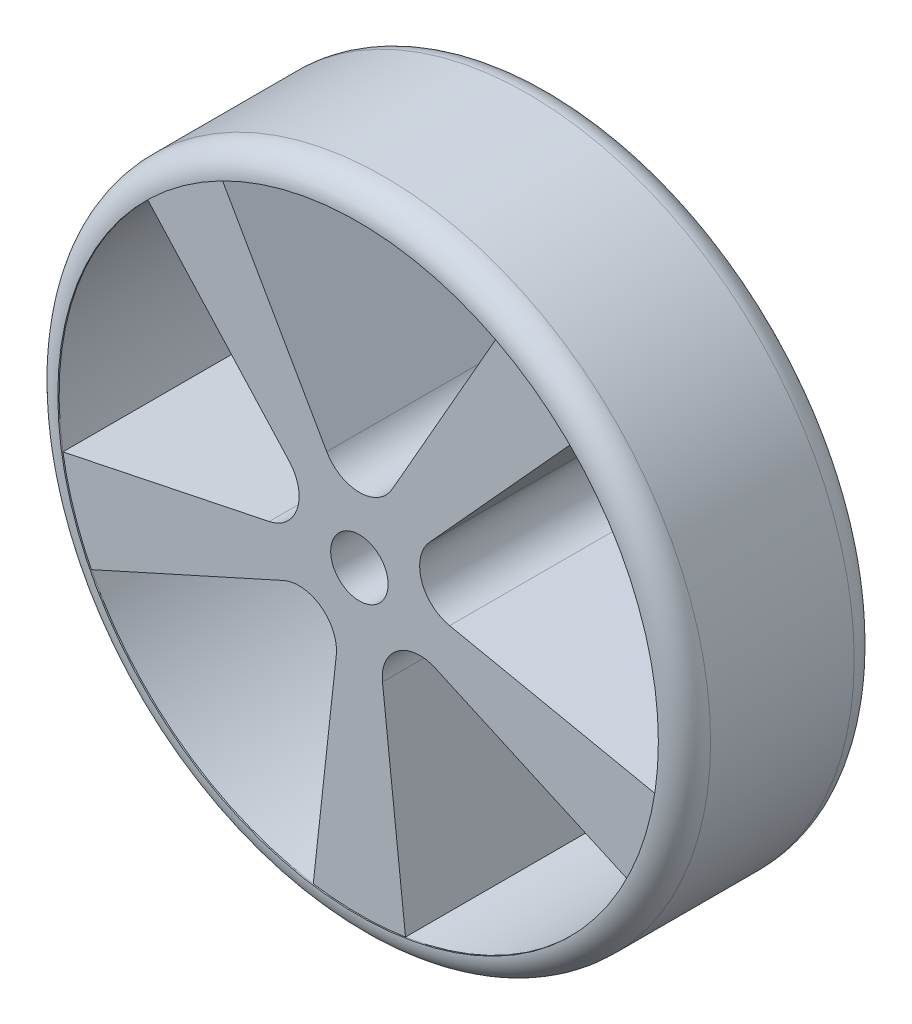
from build123d import *
from build123d.topology import SkipClean

# Parameters (mm, degrees)
SKETCH1_R               = 25
BOSS_EXTRUDE1_DEPTH     = 15
FILLET1_R               = 2
CUT_EXTRUDE2_DEPTH      = 39.405728804
CUT_EXTRUDE2_DEPTH_BACK = 39.405728804
SKETCH7_R               = 2.2
SKETCH8_R               = 23
CUT_EXTRUDE3_DEPTH      = 0.1
CUT_EXTRUDE4_START      = -0.1
SKETCH9_R               = 23
CUT_EXTRUDE4_DEPTH      = 0.1
BOSS_EXTRUDE3_START     = -0.1
SKETCH10_R              = 23
BOSS_EXTRUDE3_DEPTH     = 0.1
SKETCH11_R              = 2.2
CUT_EXTRUDE5_DEPTH      = 37.142080806
SKETCH12_R              = 23
BOSS_EXTRUDE4_DEPTH     = 0.1
SKETCH13_R              = 2.2
CUT_EXTRUDE6_DEPTH      = 39.366782573
CUT_EXTRUDE7_DEPTH      = 39.366782573
CIRPATTERN1_COUNT       = 5


with BuildPart() as part:
    # Sketch1 → Boss-Extrude1 (new body)
    with BuildSketch(Plane.XY):
        Circle(SKETCH1_R)
    extrude(amount=BOSS_EXTRUDE1_DEPTH)

    # Fillet1
    fillet1_edges = [part.edges().sort_by_distance(p)[0] for p in [
        (-25, 0, 15),
        (-25, 0, 0),
    ]]
    fillet(fillet1_edges, radius=FILLET1_R)

    # Sketch7 → Cut-Extrude2 (cut, two sides: drawn at the far end of the back side and taken through both)
    with BuildSketch(Plane.XY.offset(15).offset(-CUT_EXTRUDE2_DEPTH_BACK)):
        Circle(SKETCH7_R)
    extrude(amount=CUT_EXTRUDE2_DEPTH + CUT_EXTRUDE2_DEPTH_BACK, mode=Mode.SUBTRACT)

    # Sketch8 → Cut-Extrude3 (cut)
    with BuildSketch(Plane.XY.offset(15)):
        Circle(SKETCH8_R)
    extrude(amount=-CUT_EXTRUDE3_DEPTH, mode=Mode.SUBTRACT)

    # Sketch9 → Cut-Extrude4 (cut)
    with BuildSketch(Plane(origin=(0, 0, 0), x_dir=(-1, 0, 0), z_dir=(0, 0, -1)).offset(CUT_EXTRUDE4_START)):
        Circle(SKETCH9_R)
    extrude(amount=CUT_EXTRUDE4_DEPTH, mode=Mode.SUBTRACT)

    # Sketch10 → Boss-Extrude3 (add)
    with BuildSketch(Plane(origin=(0, 0, 0.1), x_dir=(-1, 0, 0), z_dir=(0, 0, -1)).offset(BOSS_EXTRUDE3_START)):
        Circle(SKETCH10_R)
    extrude(amount=BOSS_EXTRUDE3_DEPTH)

    # Sketch11 → Cut-Extrude5 (cut, through all)
    with SkipClean():  # the faces are left unmerged after this step: merging them gives an invalid solid
        with BuildSketch(Plane(origin=(0, 0, 7.5), x_dir=(-1, 0, 0), z_dir=(0, 0, -1))):
            Circle(SKETCH11_R)
        extrude(amount=CUT_EXTRUDE5_DEPTH, mode=Mode.SUBTRACT)

    # Sketch12 → Boss-Extrude4 (add)
    with SkipClean():  # the faces are left unmerged after this step: merging them gives an invalid solid
        with BuildSketch(Plane.XY.offset(14.9)):
            Circle(SKETCH12_R)
        extrude(amount=-BOSS_EXTRUDE4_DEPTH)

    # Sketch13 → Cut-Extrude6 (cut, through all)
    with SkipClean():  # the faces are left unmerged after this step: merging them gives an invalid solid
        with BuildSketch(Plane(origin=(0, 0, 0.1), x_dir=(-1, 0, 0), z_dir=(0, 0, -1))):
            Circle(SKETCH13_R)
        extrude(amount=-CUT_EXTRUDE6_DEPTH, mode=Mode.SUBTRACT)

    # Sketch14 → Cut-Extrude7 (cut, through all)
    with SkipClean():  # the faces are left unmerged after this step: merging them gives an invalid solid
        with BuildSketch(Plane.XY.offset(14.9)):
            with BuildLine():
                Line((-2.5, 6.451420974), (-10.5, 20.46338193))
                ThreePointArc((-10.5, 20.46338193), (0, 23.249741533), (10.5, 20.46338193))
                Line((10.5, 20.46338193), (2.5, 6.451420974))
                ThreePointArc((2.5, 6.451420974), (0, 5), (-2.5, 6.451420974))
            make_face()
        cut_extrude7 = extrude(amount=-CUT_EXTRUDE7_DEPTH, mode=Mode.SUBTRACT)

    # CirPattern1: Cut-Extrude7 ×5 about axis
    with SkipClean():  # the faces are left unmerged after this step: merging them gives an invalid solid
        cirpattern1_axis = Axis((0, 0, 15.000012), (0, 0, -1))
        for i in range(1, CIRPATTERN1_COUNT):
            add(cut_extrude7.rotate(cirpattern1_axis, i * 360 / CIRPATTERN1_COUNT), mode=Mode.SUBTRACT)


solid = part.part
